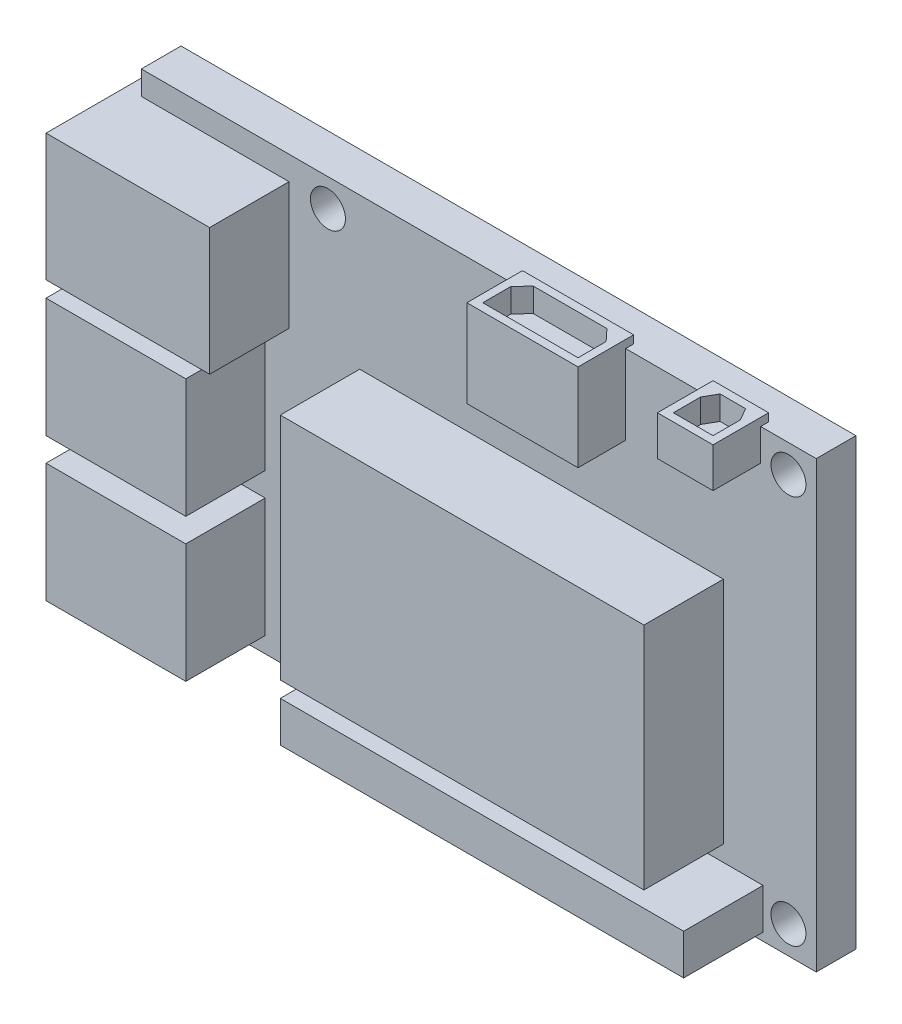
from build123d import *

# Parameters (mm, degrees)
CROQUIS1_W                   = 85
CROQUIS1_H                   = 56
CROQUIS1_R                   = 2.2000083
SALIENTE_EXTRUIR3_DEPTH      = 5
SALIENTE_EXTRUIR4_DEPTH      = 10
SALIENTE_EXTRUIR4_DEPTH_BACK = 3
CROQUIS2_W                   = 20.6
CROQUIS2_H                   = 16
CROQUIS3_W                   = 50.8
CROQUIS3_H                   = 5.1
SALIENTE_EXTRUIR5_DEPTH      = 10
CROQUIS4_W                   = 11
CROQUIS4_H                   = 14
CORTAR_EXTRUIR2_DEPTH        = 15
CROQUIS5_W                   = 45.8
CROQUIS5_H                   = 28.9
SALIENTE_EXTRUIR6_DEPTH      = 10
SALIENTE_EXTRUIR8_DEPTH      = 10
SALIENTE_EXTRUIR8_DEPTH_BACK = 3
CROQUIS6_W                   = 17.6
CROQUIS6_H                   = 15
CROQUIS7_W                   = 5
CROQUIS7_H                   = 13
CORTAR_EXTRUIR3_DEPTH        = 15
SALIENTE_EXTRUIR9_DEPTH      = 6
SALIENTE_EXTRUIR9_DEPTH_BACK = 1
CROQUIS8_W                   = 7
CROQUIS8_H                   = 5
CROQUIS8_W_2                 = 14
CROQUIS8_H_2                 = 11
CORTAR_EXTRUIR4_DEPTH        = 3


with BuildPart() as part:
    # Croquis1 → Saliente-Extruir3 (new body)
    with BuildSketch(Plane.XY):
        with Locations((42.5, 28)):
            Rectangle(CROQUIS1_W, CROQUIS1_H)
        with Locations((23.5, 52.5)):
            Circle(CROQUIS1_R, mode=Mode.SUBTRACT)
        with Locations((23.5, 3.5)):
            Circle(CROQUIS1_R, mode=Mode.SUBTRACT)
        with Locations((81.5, 52.5)):
            Circle(CROQUIS1_R, mode=Mode.SUBTRACT)
        with Locations((81.5, 3.5)):
            Circle(CROQUIS1_R, mode=Mode.SUBTRACT)
    extrude(amount=SALIENTE_EXTRUIR3_DEPTH)

    # Croquis2 → Saliente-Extruir4 (add, two sides: drawn at the far end of the back side and taken through both)
    with BuildSketch(Plane.XY.offset(5).offset(-SALIENTE_EXTRUIR4_DEPTH_BACK)):
        with Locations((8.3, 45)):
            Rectangle(CROQUIS2_W, CROQUIS2_H)
    extrude(amount=SALIENTE_EXTRUIR4_DEPTH + SALIENTE_EXTRUIR4_DEPTH_BACK)

    # Croquis3 → Saliente-Extruir5 (add)
    with BuildSketch(Plane.XY.offset(5)):
        with Locations((52.9, 3.55)):
            Rectangle(CROQUIS3_W, CROQUIS3_H)
    extrude(amount=SALIENTE_EXTRUIR5_DEPTH)

    # Croquis4 → Cortar-Extruir2 (cut)
    with BuildSketch(Plane.ZY.offset(2)):
        with Locations((8.5, 45)):
            Rectangle(CROQUIS4_W, CROQUIS4_H)
    extrude(amount=-CORTAR_EXTRUIR2_DEPTH, mode=Mode.SUBTRACT)

    # Croquis5 → Saliente-Extruir6 (add)
    with BuildSketch(Plane.XY.offset(5)):
        with Locations((50.4, 22.55)):
            Rectangle(CROQUIS5_W, CROQUIS5_H)
    extrude(amount=SALIENTE_EXTRUIR6_DEPTH)

    # Croquis6 → Saliente-Extruir8 (add, two sides: drawn at the far end of the back side and taken through both)
    with BuildSketch(Plane.XY.offset(5).offset(-SALIENTE_EXTRUIR8_DEPTH_BACK)):
        with Locations((6.8, 27.5)):
            Rectangle(CROQUIS6_W, CROQUIS6_H)
        with Locations((6.8, 9.5)):
            Rectangle(CROQUIS6_W, CROQUIS6_H)
    extrude(amount=SALIENTE_EXTRUIR8_DEPTH + SALIENTE_EXTRUIR8_DEPTH_BACK)

    # Croquis7 → Cortar-Extruir3 (cut)
    with BuildSketch(Plane.ZY.offset(2)):
        with Locations((5.5, 27.5)):
            Rectangle(CROQUIS7_W, CROQUIS7_H)
        with Locations((11.5, 27.5)):
            Rectangle(CROQUIS7_W, CROQUIS7_H)
        with Locations((11.5, 9.5)):
            Rectangle(CROQUIS7_W, CROQUIS7_H)
        with Locations((5.5, 9.5)):
            Rectangle(CROQUIS7_W, CROQUIS7_H)
    extrude(amount=-CORTAR_EXTRUIR3_DEPTH, mode=Mode.SUBTRACT)

    # Croquis8 → Saliente-Extruir9 (add, two sides: drawn at the far end of the back side and taken through both)
    with BuildSketch(Plane.XY.offset(5).offset(-SALIENTE_EXTRUIR9_DEPTH_BACK)):
        with Locations((74.5, 54.5)):
            Rectangle(CROQUIS8_W, CROQUIS8_H)
        with Locations((54, 51.5)):
            Rectangle(CROQUIS8_W_2, CROQUIS8_H_2)
    extrude(amount=SALIENTE_EXTRUIR9_DEPTH + SALIENTE_EXTRUIR9_DEPTH_BACK)

    # Croquis9 → Cortar-Extruir4 (cut)
    with BuildSketch(Plane(origin=(0, 57, 0), x_dir=(1, 0, 0), z_dir=(0, 1, 0))):
        Polygon((48, -10), (60, -10), (60, -6.462110536), (58.635363499, -5), (49.364636501, -5), (48, -6.462110536), align=None)
        Polygon((72, -10), (77, -10), (77, -6.561817621), (76.105167212, -5), (72.894832788, -5), (72, -6.561817621), align=None)
    extrude(amount=-CORTAR_EXTRUIR4_DEPTH, mode=Mode.SUBTRACT)


solid = part.part
